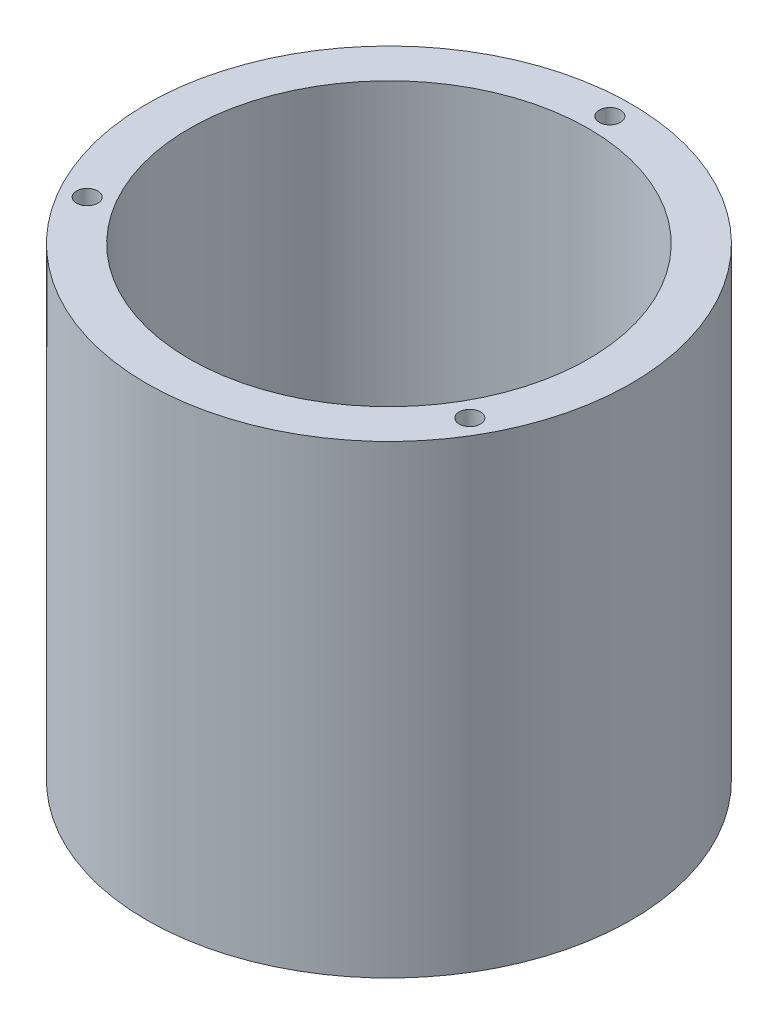
from build123d import *

# Parameters (mm, degrees)
SKETCH1_R           = 45.5
SKETCH1_R_2         = 33.5
BOSS_EXTRUDE1_DEPTH = 4
SKETCH2_R           = 45.5
SKETCH2_R_2         = 37.5
BOSS_EXTRUDE2_DEPTH = 83.3
SKETCH4_R           = 2
CUT_EXTRUDE1_DEPTH  = 6
CIRPATTERN1_COUNT   = 3


with BuildPart() as part:
    # Sketch1 → Boss-Extrude1 (new body)
    with BuildSketch(Plane(origin=(0, 0, 0), x_dir=(1, 0, 0), z_dir=(0, 1, 0))):
        Circle(SKETCH1_R)
        Circle(SKETCH1_R_2, mode=Mode.SUBTRACT)
    extrude(amount=BOSS_EXTRUDE1_DEPTH)

    # Sketch2 → Boss-Extrude2 (add)
    with BuildSketch(Plane(origin=(0, 4, 0), x_dir=(1, 0, 0), z_dir=(0, 1, 0))):
        Circle(SKETCH2_R)
        Circle(SKETCH2_R_2, mode=Mode.SUBTRACT)
    extrude(amount=BOSS_EXTRUDE2_DEPTH)

    # Sketch4 → Cut-Extrude1 (cut)
    with BuildSketch(Plane(origin=(0, 87.3, 0), x_dir=(1, 0, 0), z_dir=(0, 1, 0))):
        with Locations((0, 41.5)):
            Circle(SKETCH4_R)
    cut_extrude1 = extrude(amount=-CUT_EXTRUDE1_DEPTH, mode=Mode.SUBTRACT)

    # CirPattern1: Cut-Extrude1 ×3 about axis
    cirpattern1_axis = Axis((0, 87.3, 0), (0, 1, 0))
    for i in range(1, CIRPATTERN1_COUNT):
        add(cut_extrude1.rotate(cirpattern1_axis, i * 360 / CIRPATTERN1_COUNT), mode=Mode.SUBTRACT)


solid = part.part
